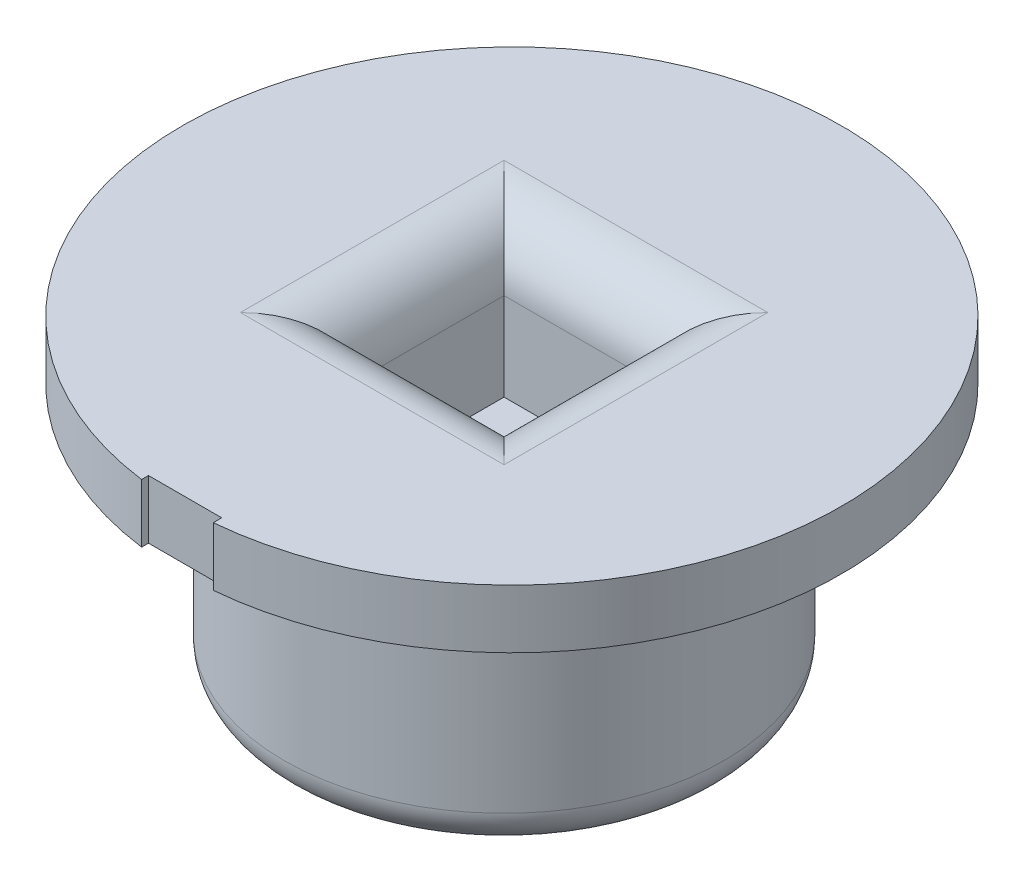
from build123d import *

# Parameters (mm, degrees)
SKETCH_1_R          = 3
EXTRUDE_1_DEPTH     = 3.5
SKETCH_2_R          = 4.5
EXTRUDE_2_DEPTH     = 0.8
SKETCH_4_W          = 2
SKETCH_4_H          = 2
CUT_EXTRUDE_1_DEPTH = 2
FILLET_1_R          = 0.5
FILLET_2_R          = 0.8
SKETCH_5_W          = 1
SKETCH_5_H          = 0.656693248
CUT_EXTRUDE_2_DEPTH = 1


with BuildPart() as part:
    # 草图1 → 凸台-拉伸1 (new body)
    with BuildSketch(Plane(origin=(0, 0, 0), x_dir=(1, 0, 0), z_dir=(0, 1, 0))):
        Circle(SKETCH_1_R)
    extrude(amount=EXTRUDE_1_DEPTH)

    # 草图2 → 凸台-拉伸2 (add)
    with BuildSketch(Plane(origin=(0, 3.5, 0), x_dir=(1, 0, 0), z_dir=(0, 1, 0))):
        with Locations((0.094879954, 0.012027373)):
            Circle(SKETCH_2_R)
    extrude(amount=EXTRUDE_2_DEPTH)

    # 草图4 → 切除-拉伸1 (cut)
    with BuildSketch(Plane(origin=(0, 4.3, 0), x_dir=(1, 0, 0), z_dir=(0, 1, 0))):
        Rectangle(SKETCH_4_W, SKETCH_4_H)
    extrude(amount=-CUT_EXTRUDE_1_DEPTH, mode=Mode.SUBTRACT)

    # 圆角1
    fillet_1_edges = [part.edges().sort_by_distance(p)[0] for p in [
        (-3, 0, 0),
    ]]
    fillet(fillet_1_edges, radius=FILLET_1_R)

    # 圆角2
    fillet_2_edges = [part.edges().sort_by_distance(p)[0] for p in [
        (0, 4.3, 1),
        (-1, 4.3, 0),
        (0, 4.3, -1),
        (1, 4.3, 0),
    ]]
    fillet(fillet_2_edges, radius=FILLET_2_R)

    # 草图5 → 切除-拉伸2 (cut)
    with BuildSketch(Plane.XZ.offset(-3.5)):
        with Locations((0, 4.682753302)):
            Rectangle(SKETCH_5_W, SKETCH_5_H)
    extrude(amount=-CUT_EXTRUDE_2_DEPTH, mode=Mode.SUBTRACT)


solid = part.part
